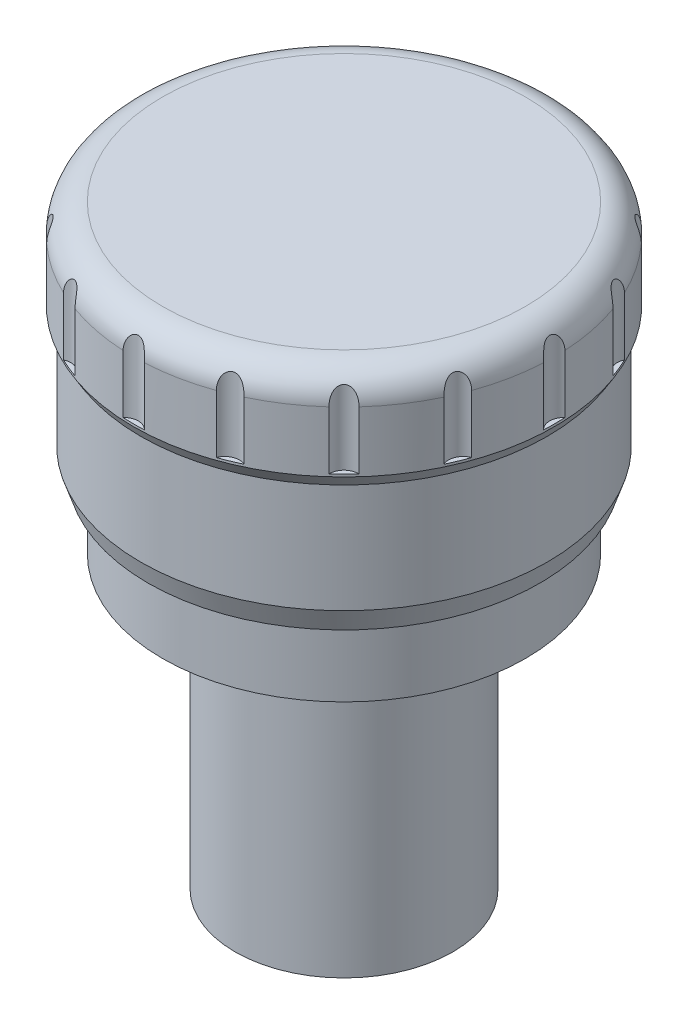
from build123d import *

# Parameters (mm, degrees)
SKETCH1_R           = 12.5
BOSS_EXTRUDE1_DEPTH = 5
SKETCH2_R           = 7.5
BOSS_EXTRUDE2_DEPTH = 20
SKETCH3_R           = 14
BOSS_EXTRUDE3_DEPTH = 9
CHAMFER1_SIZE       = 0.5
CHAMFER1_SIZE2      = 1.5
SKETCH4_R           = 14.5
BOSS_EXTRUDE4_DEPTH = 7
FILLET3_R           = 2
CHAMFER2_SIZE2      = 0.5
CHAMFER2_SIZE       = 0.832139741
CUT_EXTRUDE2_DEPTH  = 6
CIRPATTERN1_COUNT   = 16


with BuildPart() as part:
    # Sketch1 → Boss-Extrude1 (new body)
    with BuildSketch(Plane(origin=(0, 0, 0), x_dir=(1, 0, 0), z_dir=(0, 1, 0))):
        with Locations(Location((0, 0, 0), (0, 0, 270))):
            Circle(SKETCH1_R)
    extrude(amount=BOSS_EXTRUDE1_DEPTH)

    # Sketch2 → Boss-Extrude2 (add)
    with BuildSketch(Plane.XZ):
        with Locations(Location((0, 0, 0), (0, 0, 90))):
            Circle(SKETCH2_R)
    extrude(amount=BOSS_EXTRUDE2_DEPTH)

    # Sketch3 → Boss-Extrude3 (add)
    with BuildSketch(Plane(origin=(0, 5, 0), x_dir=(1, 0, 0), z_dir=(0, 1, 0))):
        with Locations(Location((0, 0, 0), (0, 0, 270))):
            Circle(SKETCH3_R)
    extrude(amount=BOSS_EXTRUDE3_DEPTH)

    # Chamfer1
    chamfer1_edges = [part.edges().sort_by_distance(p)[0] for p in [
        (0, 5, -14),
    ]]
    chamfer1_side = [part.faces().sort_by_distance(p)[0] for p in [
        (0, 5, -13.604020203),
    ]]
    chamfer(chamfer1_edges, length=CHAMFER1_SIZE, length2=CHAMFER1_SIZE2, reference=chamfer1_side[0])

    # Sketch4 → Boss-Extrude4 (add)
    with BuildSketch(Plane(origin=(0, 14, 0), x_dir=(1, 0, 0), z_dir=(0, 1, 0))):
        with Locations(Location((0, 0, 0), (0, 0, 270))):
            Circle(SKETCH4_R)
    extrude(amount=BOSS_EXTRUDE4_DEPTH)

    # Fillet3
    fillet3_edges = [part.edges().sort_by_distance(p)[0] for p in [
        (0, 21, -14.5),
    ]]
    fillet(fillet3_edges, radius=FILLET3_R)

    # Chamfer2
    chamfer2_edges = [part.edges().sort_by_distance(p)[0] for p in [
        (0, 14, -14.5),
    ]]
    chamfer2_side = [part.faces().sort_by_distance(p)[0] for p in [
        (0, 14.01, -14.5),
    ]]
    chamfer(chamfer2_edges, length=CHAMFER2_SIZE - 0.0001, length2=CHAMFER2_SIZE2 - 0.0001, reference=chamfer2_side[0])  # a hair under: the kernel refuses the full size

    # Sketch5 → Cut-Extrude2 (cut)
    with BuildSketch(Plane(origin=(0, 21, 0), x_dir=(1, 0, 0), z_dir=(0, 1, 0))):
        with BuildLine():
            Line((-0.75, 14.5), (0.75, 14.5))
            ThreePointArc((0.75, 14.5), (0, 14.161437828), (-0.75, 14.5))
        make_face()
    cut_extrude2 = extrude(amount=-CUT_EXTRUDE2_DEPTH, mode=Mode.SUBTRACT)

    # CirPattern1: Cut-Extrude2 ×16 about axis
    cirpattern1_axis = Axis((0, 0, 0), (0, 1, 0))
    for i in range(1, CIRPATTERN1_COUNT):
        add(cut_extrude2.rotate(cirpattern1_axis, i * 360 / CIRPATTERN1_COUNT), mode=Mode.SUBTRACT)


solid = part.part
